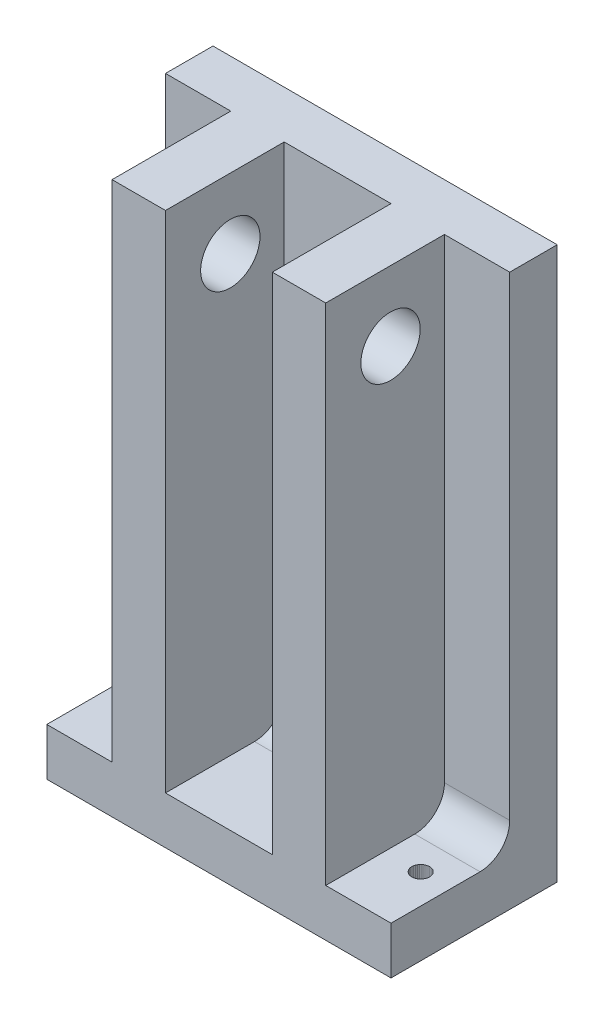
from build123d import *

# Parameters (mm, degrees)
SKETCH1_W           = 57.999998332
SKETCH1_H           = 28.000000864
BOSS_EXTRUDE1_DEPTH = 8
CUT_EXTRUDE2_REACH  = 43.097
CUT_EXTRUDE3_DEPTH  = 42.097445176
CUT_EXTRUDE4_DEPTH  = 42.097445176
SKETCH8_W           = 5.00000082
SKETCH8_H           = 4.999999888
BOSS_EXTRUDE2_DEPTH = 4.999995232
SKETCH9_W           = 5.00000082
SKETCH9_H           = 4.999999888
BOSS_EXTRUDE3_DEPTH = 4.999995232
BOSS_EXTRUDE4_DEPTH = 85
FILLET1_R           = 5
FILLET2_R           = 5
FILLET3_R           = 5
HOLE1_START         = -18
HOLE1_OUTLINE_R     = 5
HOLE1_DEPTH         = 36


# Read off the part's stored shape, not the designer's step: Hole1
with BuildPart() as part:
    # Sketch1 → Boss-Extrude1 (new body)
    with BuildSketch(Plane.XZ):
        with Locations((0, 14.000000432)):
            Rectangle(SKETCH1_W, SKETCH1_H)
    extrude(amount=BOSS_EXTRUDE1_DEPTH)

    # Sketch3 → Cut-Extrude2 (cut, up to next)
    with BuildSketch(Plane.XZ.offset(8), mode=Mode.PRIVATE) as cut_extrude2_sk1:
        Polygon((0, 4.350000061), (-0.277837098, 4.325692076), (-0.547232223, 4.253508057), (-0.79999998, 4.135640804), (-1.028459985, 3.975670785), (-1.225671032, 3.77845997), (-1.385641051, 3.550000023), (-1.503507956, 3.297232091), (-1.575691975, 3.027837025), (-1.59999996, 2.749999985), (-1.575691975, 2.472162945), (-1.503507956, 2.202768112), (-1.385641051, 1.949999947), (-1.225671032, 1.72154), (-1.028459985, 1.524328953), (-0.79999998, 1.36435905), (-0.547232223, 1.246492029), (-0.277837098, 1.17430801), (0, 1.150000026), (0.277837098, 1.17430801), (0.547232223, 1.246492029), (0.79999998, 1.36435905), (1.028459985, 1.524328953), (1.225671032, 1.72154), (1.385641051, 1.949999947), (1.503507956, 2.202768112), (1.575691975, 2.472162945), (1.59999996, 2.749999985), (1.575691975, 3.027837025), (1.503507956, 3.297232091), (1.385641051, 3.550000023), (1.225671032, 3.77845997), (1.028459985, 3.975670785), (0.79999998, 4.135640804), (0.547232223, 4.253508057), (0.277837098, 4.325692076), align=None)
    cut_extrude2_tool1 = extrude(cut_extrude2_sk1.sketch, amount=-CUT_EXTRUDE2_REACH, mode=Mode.PRIVATE) & part.part
    add(cut_extrude2_tool1.solids().sort_by_distance((0, -8, 2.75))[0], mode=Mode.SUBTRACT)

    # Sketch4 → Cut-Extrude3 (cut, through all)
    with BuildSketch(Plane.XZ.offset(8)):
        Polygon((-23.035820574, 16.850929707), (-22.850930691, 17.03581959), (-22.700959817, 17.249999568), (-22.590460256, 17.486970872), (-22.522790357, 17.739530653), (-22.500000894, 17.999999225), (-22.522790357, 18.26046966), (-22.590460256, 18.513029441), (-22.700959817, 18.750000745), (-22.850930691, 18.964180723), (-23.035820574, 19.149070606), (-23.250000551, 19.299039617), (-23.486969993, 19.409539178), (-23.739529774, 19.477209076), (-24.000000209, 19.500000402), (-24.260470644, 19.477209076), (-24.513030425, 19.409539178), (-24.749999866, 19.299039617), (-24.964179844, 19.149070606), (-25.149069726, 18.964180723), (-25.299040601, 18.750000745), (-25.409540161, 18.513029441), (-25.47721006, 18.26046966), (-25.499999523, 17.999999225), (-25.47721006, 17.739530653), (-25.409540161, 17.486970872), (-25.299040601, 17.249999568), (-25.149069726, 17.03581959), (-24.964179844, 16.850929707), (-24.749999866, 16.700960696), (-24.513030425, 16.590459272), (-24.260470644, 16.522789374), (-24.000000209, 16.499999911), (-23.739529774, 16.522789374), (-23.486969993, 16.590459272), (-23.250000551, 16.700960696), align=None)
    extrude(amount=-CUT_EXTRUDE3_DEPTH, mode=Mode.SUBTRACT)

    # Sketch5 → Cut-Extrude4 (cut, through all)
    with BuildSketch(Plane(origin=(0, -8, 0), x_dir=(-1, 0, 0), z_dir=(0, 1, 0))):
        Polygon((-23.486969993, 16.590459272), (-23.250000551, 16.700960696), (-23.035820574, 16.850929707), (-22.850930691, 17.03581959), (-22.700959817, 17.249999568), (-22.590460256, 17.486970872), (-22.522790357, 17.739530653), (-22.500000894, 17.999999225), (-22.522790357, 18.26046966), (-22.590460256, 18.513029441), (-22.700959817, 18.750000745), (-22.850930691, 18.964180723), (-23.035820574, 19.149070606), (-23.250000551, 19.299039617), (-23.486969993, 19.409539178), (-23.739529774, 19.477209076), (-24.000000209, 19.500000402), (-24.260470644, 19.477209076), (-24.513030425, 19.409539178), (-24.749999866, 19.299039617), (-24.964179844, 19.149070606), (-25.149069726, 18.964180723), (-25.299040601, 18.750000745), (-25.409540161, 18.513029441), (-25.47721006, 18.26046966), (-25.499999523, 17.999999225), (-25.47721006, 17.739530653), (-25.409540161, 17.486970872), (-25.299040601, 17.249999568), (-25.149069726, 17.03581959), (-24.964179844, 16.850929707), (-24.749999866, 16.700960696), (-24.513030425, 16.590459272), (-24.260470644, 16.522789374), (-24.000000209, 16.499999911), (-23.739529774, 16.522789374), align=None)
    extrude(amount=CUT_EXTRUDE4_DEPTH, mode=Mode.SUBTRACT)

    # Sketch8 → Boss-Extrude2 (add)
    with BuildSketch(Plane.XZ.offset(8)):
        with Locations((-21.499999799, 2.499999944)):
            Rectangle(SKETCH8_W, SKETCH8_H)
    extrude(amount=BOSS_EXTRUDE2_DEPTH)

    # Sketch9 → Boss-Extrude3 (add)
    with BuildSketch(Plane.XZ.offset(8)):
        with Locations((21.499999799, 2.499999944)):
            Rectangle(SKETCH9_W, SKETCH9_H)
    extrude(amount=BOSS_EXTRUDE3_DEPTH)

    # Sketch10 → Boss-Extrude4 (add)
    with BuildSketch(Plane(origin=(0, 0, 0), x_dir=(1, 0, 0), z_dir=(0, 1, 0))):
        Polygon((9, -8), (-9, -8), (-9, -28.000000864), (-18, -28.000000864), (-18, -8), (-28.999999166, -8), (-28.999999166, 0), (28.999999166, 0), (28.999999166, -8), (18, -8), (18, -28.000000864), (9, -28.000000864), align=None)
    extrude(amount=BOSS_EXTRUDE4_DEPTH)

    # Fillet1
    fillet1_edges = [part.edges().sort_by_distance(p)[0] for p in [
        (0, 0, 8),
    ]]
    fillet(fillet1_edges, radius=FILLET1_R)

    # Fillet2
    fillet2_edges = [part.edges().sort_by_distance(p)[0] for p in [
        (23.499999583, 0, 8),
    ]]
    fillet(fillet2_edges, radius=FILLET2_R)

    # Fillet3
    fillet3_edges = [part.edges().sort_by_distance(p)[0] for p in [
        (-23.499999583, 0, 8),
    ]]
    fillet(fillet3_edges, radius=FILLET3_R)

    # Hole1 outline → Hole1 (cut)
    with BuildSketch(Plane.YZ.offset(HOLE1_START)):
        with Locations((73.240950457, 17.082405748)):
            Circle(HOLE1_OUTLINE_R)
    extrude(amount=HOLE1_DEPTH, mode=Mode.SUBTRACT)


solid = part.part
